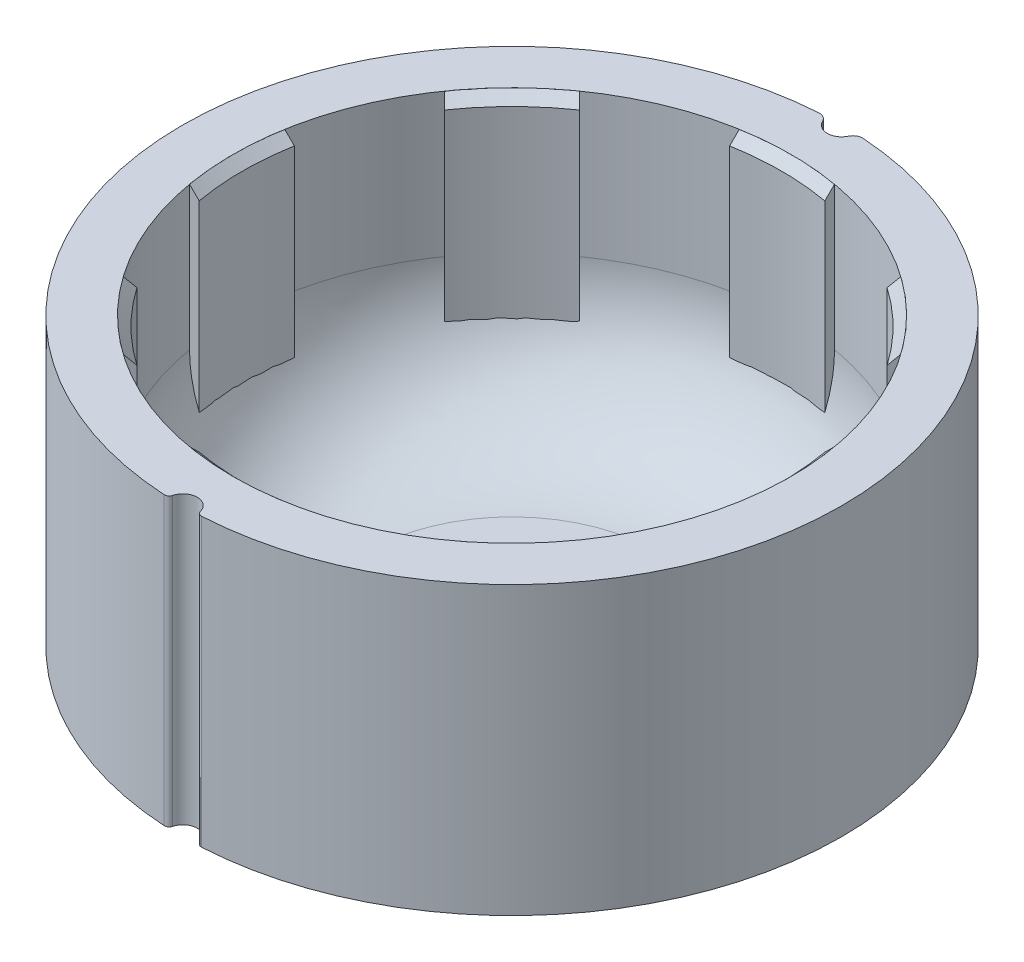
from build123d import *

# Parameters (mm, degrees)
BOSS_EXTRUDE1_DEPTH = 30
CUT_EXTRUDE2_REACH  = 60.241
CUT_EXTRUDE2_START  = 1
SKETCH2_R           = 29.2
BOSS_EXTRUDE2_DEPTH = 30
CHAMFER2_SIZE       = 1
CIRPATTERN2_COUNT   = 8
FILLET2_R           = 14


with BuildPart() as part:
    # Sketch1 → Boss-Extrude1 (new body)
    with BuildSketch(Plane(origin=(0, 0, 0), x_dir=(1, 0, 0), z_dir=(0, 1, 0))):
        with BuildLine():
            ThreePointArc((1.451818925, -34.068556857), (1.641248992, -34.346908706), (1.964225605, -34.442038138))
            ThreePointArc((1.964225605, -34.442038138), (34.499528846, -0.178302888), (2.324135821, 34.423627607))
            ThreePointArc((2.324135821, 34.423627607), (1.751838249, 34.289058819), (1.354061739, 33.856153382))
            ThreePointArc((1.354061739, 33.856153382), (0, 33.001534515), (-1.354061739, 33.856153382))
            ThreePointArc((-1.354061739, 33.856153382), (-1.751838249, 34.289058819), (-2.324135821, 34.423627607))
            ThreePointArc((-2.324135821, 34.423627607), (-34.499528846, -0.178302888), (-1.964225605, -34.442038138))
            ThreePointArc((-1.964225605, -34.442038138), (-1.641248992, -34.346908706), (-1.451818925, -34.068556857))
            ThreePointArc((-1.451818925, -34.068556857), (0, -32.945679925), (1.451818925, -34.068556857))
        make_face()
    extrude(amount=BOSS_EXTRUDE1_DEPTH)

    # Sketch2 → Cut-Extrude2 (cut, up to next)
    with BuildSketch(Plane(origin=(0, 0, 0), x_dir=(1, 0, 0), z_dir=(0, 1, 0)).offset(CUT_EXTRUDE2_START), mode=Mode.PRIVATE) as cut_extrude2_sk1:
        with Locations(Location((0, 0, 0), (0, 0, 270))):
            Circle(SKETCH2_R)
    cut_extrude2_tool1 = extrude(cut_extrude2_sk1.sketch, amount=CUT_EXTRUDE2_REACH, mode=Mode.PRIVATE) & part.part
    add(cut_extrude2_tool1.solids().sort_by_distance((0, 1, 0))[0], mode=Mode.SUBTRACT)

    # Fillet2
    fillet2_edges = [part.edges().sort_by_distance(p)[0] for p in [
        (0, 1, -29.2),
    ]]
    fillet(fillet2_edges, radius=FILLET2_R)


with BuildPart() as body_2:
    # Sketch2<2> → Boss-Extrude2 (new body)
    with BuildSketch(Plane(origin=(0, 0, 0), x_dir=(1, 0, 0), z_dir=(0, 1, 0))):
        with BuildLine():
            ThreePointArc((4.981640858, 28.771917808), (0, 29.2), (-4.981640858, 28.771917808))
            Line((-4.981640858, 28.771917808), (-4.981640858, 27.756499318))
            ThreePointArc((-4.981640858, 27.756499318), (0, 28.2), (4.981640858, 27.756499318))
            Line((4.981640858, 27.756499318), (4.981640858, 28.771917808))
        make_face()
    extrude(amount=BOSS_EXTRUDE2_DEPTH)

    # Chamfer2
    chamfer2_edges = [body_2.edges().sort_by_distance(p)[0] for p in [
        (0, 30, -28.2),
    ]]
    chamfer(chamfer2_edges, length=CHAMFER2_SIZE - 0.0001)  # a hair under: the kernel refuses the full size


with BuildPart() as cirpattern2_1:
    # CirPattern2: pattern copy
    add(body_2.part.rotate(Axis((0, 0, 0), (0, 1, 0)), 1 * 360 / CIRPATTERN2_COUNT))


with BuildPart() as cirpattern2_2:
    # CirPattern2: pattern copy
    add(body_2.part.rotate(Axis((0, 0, 0), (0, 1, 0)), 2 * 360 / CIRPATTERN2_COUNT))


with BuildPart() as cirpattern2_3:
    # CirPattern2: pattern copy
    add(body_2.part.rotate(Axis((0, 0, 0), (0, 1, 0)), 3 * 360 / CIRPATTERN2_COUNT))


with BuildPart() as cirpattern2_4:
    # CirPattern2: pattern copy
    add(body_2.part.rotate(Axis((0, 0, 0), (0, 1, 0)), 4 * 360 / CIRPATTERN2_COUNT))


with BuildPart() as cirpattern2_5:
    # CirPattern2: pattern copy
    add(body_2.part.rotate(Axis((0, 0, 0), (0, 1, 0)), 5 * 360 / CIRPATTERN2_COUNT))


with BuildPart() as cirpattern2_6:
    # CirPattern2: pattern copy
    add(body_2.part.rotate(Axis((0, 0, 0), (0, 1, 0)), 6 * 360 / CIRPATTERN2_COUNT))


with BuildPart() as cirpattern2_7:
    # CirPattern2: pattern copy
    add(body_2.part.rotate(Axis((0, 0, 0), (0, 1, 0)), 7 * 360 / CIRPATTERN2_COUNT))


solid = Compound([part.part, body_2.part, cirpattern2_1.part, cirpattern2_2.part, cirpattern2_3.part, cirpattern2_4.part, cirpattern2_5.part, cirpattern2_6.part, cirpattern2_7.part])
